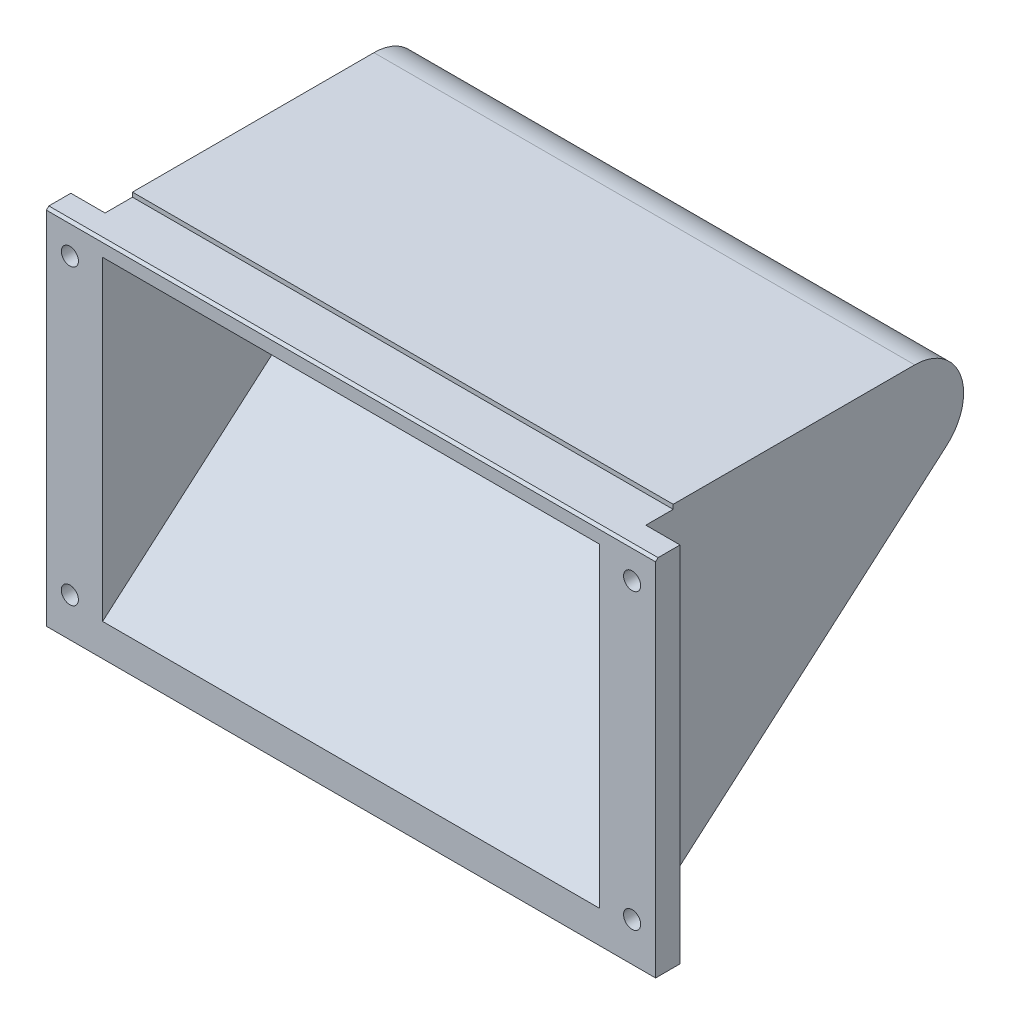
from build123d import *

# Parameters (mm, degrees)
BOSS_EXTRUDE1_DEPTH = 50.8
BOSS_EXTRUDE3_START = 4.5
BOSS_EXTRUDE3_DEPTH = 4.5
BOSS_EXTRUDE4_DEPTH = 5
SKETCH6_R           = 1.75
CUT_EXTRUDE1_DEPTH  = 18.75
SKETCH7_W           = 101.6
SKETCH7_H           = 0.5
CUT_EXTRUDE2_DEPTH  = 5.461
SKETCH8_W           = 124.6
SKETCH8_H           = 0.9
CUT_EXTRUDE3_DEPTH  = 10.6
FILLET1_SIZE        = 0.5


with BuildPart() as part:
    # Sketch1 → Boss-Extrude1 (new, symmetric)
    with BuildSketch(Plane(origin=(0, 0, 0), x_dir=(0, 0, -1), z_dir=(1, 0, 0))):
        with BuildLine():
            Line((0, 0), (60, 0))
            ThreePointArc((60, 0), (64.685586675, -3.254927648), (63.270675103, -8.781888995))
            Line((63.270675103, -8.781888995), (0, -63.5))
            Line((0, -63.5), (0, -70.110453145))
            Line((0, -70.110453145), (66.541350207, -12.56377799))
            ThreePointArc((66.541350207, -12.56377799), (69.37117335, -1.509855296), (60, 5))
            Line((60, 5), (0, 5))
            Line((0, 5), (0, 0))
        make_face()
    extrude(amount=BOSS_EXTRUDE1_DEPTH, both=True)

    # Sketch3 → Boss-Extrude3 (add)
    with BuildSketch(Plane(origin=(50.8, 0, 0), x_dir=(0, 0, -1), z_dir=(1, 0, 0)).offset(BOSS_EXTRUDE3_START)):
        with BuildLine():
            Line((0, -70.110453145), (66.541350207, -12.56377799))
            ThreePointArc((66.541350207, -12.56377799), (69.37117335, -1.509855296), (60, 5))
            Line((60, 5), (0, 5))
            Line((0, 5), (0, -70.110453145))
        make_face()
    boss_extrude3 = extrude(amount=-BOSS_EXTRUDE3_DEPTH)

    # Mirror1: Boss-Extrude3 across plane
    add(boss_extrude3.mirror(Plane(origin=(0, 0, 0), x_dir=(0, 0, 1), z_dir=(1, 0, 0))))

    # Sketch4 → Boss-Extrude4 (add)
    with BuildSketch(Plane.XY):
        Polygon((-50.8, 5), (-62.3, 5), (-62.3, -70.110453145), (62.3, -70.110453145), (62.3, 5), (50.8, 5), (50.8, -63.5), (-50.8, -63.5), align=None)
    extrude(amount=-BOSS_EXTRUDE4_DEPTH)

    # Sketch6 → Cut-Extrude1 (cut)
    with BuildSketch(Plane.XY):
        with Locations((-57.5, -2.146)):
            Circle(SKETCH6_R)
        with Locations((-57.5, -62.146)):
            Circle(SKETCH6_R)
        with Locations((57.5, -62.146)):
            Circle(SKETCH6_R)
        with Locations((57.5, -2.146)):
            Circle(SKETCH6_R)
    extrude(amount=-CUT_EXTRUDE1_DEPTH, mode=Mode.SUBTRACT)

    # Sketch7 → Cut-Extrude2 (cut)
    with BuildSketch(Plane.XY):
        with Locations((0, 0.25)):
            Rectangle(SKETCH7_W, SKETCH7_H)
    extrude(amount=-CUT_EXTRUDE2_DEPTH, mode=Mode.SUBTRACT)

    # Sketch8 → Cut-Extrude3 (cut)
    with BuildSketch(Plane.XY):
        with Locations((0, 4.55)):
            Rectangle(SKETCH8_W, SKETCH8_H)
    extrude(amount=-CUT_EXTRUDE3_DEPTH, mode=Mode.SUBTRACT)

    # Fillet1
    fillet1_edges = [part.edges().sort_by_distance(p)[0] for p in [
        (0, 0.5, 0),
        (0, 4.1, 0),
    ]]
    chamfer(fillet1_edges, length=FILLET1_SIZE)


solid = part.part
